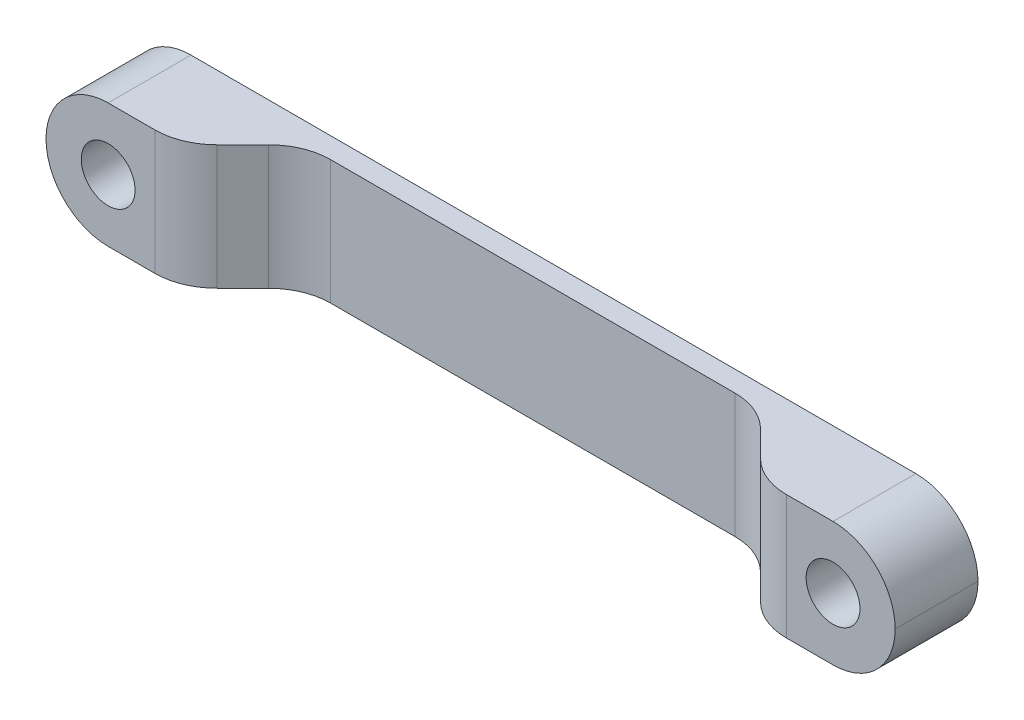
from build123d import *

# Parameters (mm, degrees)
SKETCH1_W               = 41
SKETCH1_H               = 6
SKETCH1_R               = 1.3
BOSS_EXTRUDE1_DEPTH     = 4
FILLET1_R               = 3
CUT_EXTRUDE1_DEPTH      = 22.731313812
CUT_EXTRUDE1_DEPTH_BACK = 22.731313812
FILLET2_R               = 3


with BuildPart() as part:
    # Sketch1 → Boss-Extrude1 (new body)
    with BuildSketch(Plane.XY):
        Rectangle(SKETCH1_W, SKETCH1_H)
        with Locations((17.5, 0)):
            Circle(SKETCH1_R, mode=Mode.SUBTRACT)
        with Locations((-17.5, 0)):
            Circle(SKETCH1_R, mode=Mode.SUBTRACT)
    extrude(amount=BOSS_EXTRUDE1_DEPTH)

    # Fillet1
    fillet1_edges = [part.edges().sort_by_distance(p)[0] for p in [
        (-20.5, -3, 2),
        (-20.5, 3, 2),
        (20.5, -3, 2),
        (20.5, 3, 2),
    ]]
    fillet(fillet1_edges, radius=FILLET1_R - 0.0001)  # a hair under: the kernel refuses the full size

    # Sketch2 → Cut-Extrude1 (cut, two sides: drawn at the far end of the back side and taken through both)
    with BuildSketch(Plane.XZ.offset(3).offset(-CUT_EXTRUDE1_DEPTH_BACK)):
        Polygon((-70.188274573, 60.188274573), (-14, 4), (-11, 1), (11, 1), (14, 4), (70.188274573, 60.188274573), (70.188274573, 219.112714467), (-70.188274573, 219.112714467), align=None)
    extrude(amount=CUT_EXTRUDE1_DEPTH + CUT_EXTRUDE1_DEPTH_BACK, mode=Mode.SUBTRACT)

    # Fillet2
    fillet2_edges = [part.edges().sort_by_distance(p)[0] for p in [
        (-11, 0, 1),
        (11, 0, 1),
        (14, 0, 4),
        (-14, 0, 4),
    ]]
    fillet(fillet2_edges, radius=FILLET2_R)


solid = part.part
